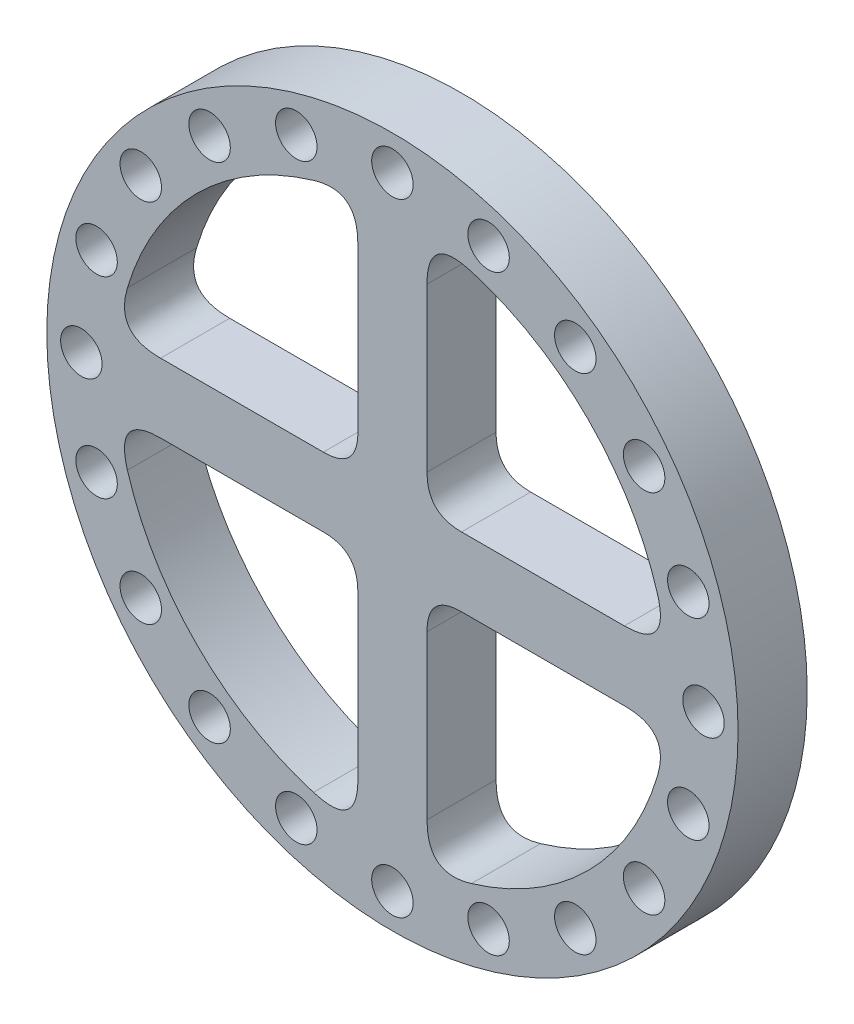
from build123d import *

# Parameters (mm, degrees)
ESBO_O1_R                = 50
ESBO_O1_R_2              = 40
RESSALTO_EXTRUS_O1_DEPTH = 10
ESBO_O2_R                = 3
CORTE_EXTRUS_O1_DEPTH    = 10
RESSALTO_EXTRUS_O2_START = -10
RESSALTO_EXTRUS_O2_DEPTH = 10
FILETE3_SIZE             = 5


with BuildPart() as part:
    # Esboço1 → Ressalto-extrusão1 (new body)
    with BuildSketch(Plane.XY):
        Circle(ESBO_O1_R)
        Circle(ESBO_O1_R_2, mode=Mode.SUBTRACT)
    extrude(amount=RESSALTO_EXTRUS_O1_DEPTH)

    # Esboço2 → Corte-extrusão1 (cut)
    with BuildSketch(Plane.XY.offset(10)):
        with Locations((45, 0)):
            Circle(ESBO_O2_R)
        with Locations((42.797543233, -13.905764747)):
            Circle(ESBO_O2_R)
        with Locations((36.405764747, -26.450336353)):
            Circle(ESBO_O2_R)
        with Locations((26.450336353, -36.405764747)):
            Circle(ESBO_O2_R)
        with Locations((13.905764747, -42.797543233)):
            Circle(ESBO_O2_R)
        with Locations((0, -45)):
            Circle(ESBO_O2_R)
        with Locations((-13.905764747, -42.797543233)):
            Circle(ESBO_O2_R)
        with Locations((-26.450336353, -36.405764747)):
            Circle(ESBO_O2_R)
        with Locations((-36.405764747, -26.450336353)):
            Circle(ESBO_O2_R)
        with Locations((-42.797543233, -13.905764747)):
            Circle(ESBO_O2_R)
        with Locations((-45, 0)):
            Circle(ESBO_O2_R)
        with Locations((-42.797543233, 13.905764747)):
            Circle(ESBO_O2_R)
        with Locations((-36.405764747, 26.450336353)):
            Circle(ESBO_O2_R)
        with Locations((-26.450336353, 36.405764747)):
            Circle(ESBO_O2_R)
        with Locations((-13.905764747, 42.797543233)):
            Circle(ESBO_O2_R)
        with Locations((0, 45)):
            Circle(ESBO_O2_R)
        with Locations((13.905764747, 42.797543233)):
            Circle(ESBO_O2_R)
        with Locations((26.450336353, 36.405764747)):
            Circle(ESBO_O2_R)
        with Locations((36.405764747, 26.450336353)):
            Circle(ESBO_O2_R)
        with Locations((42.797543233, 13.905764747)):
            Circle(ESBO_O2_R)
    extrude(amount=-CORTE_EXTRUS_O1_DEPTH, mode=Mode.SUBTRACT)

    # Esboço3 → Ressalto-extrusão2 (add)
    with BuildSketch(Plane.XY.offset(10).offset(RESSALTO_EXTRUS_O2_START)):
        with BuildLine():
            Line((-39.686269666, -5), (-5, -5))
            Line((-5, -5), (-5, -39.686269666))
            ThreePointArc((-5, -39.686269666), (0, -40), (5, -39.686269666))
            Line((5, -39.686269666), (5, -5))
            Line((5, -5), (39.686269666, -5))
            ThreePointArc((39.686269666, -5), (40, 0), (39.686269666, 5))
            Line((39.686269666, 5), (5, 5))
            Line((5, 5), (5, 39.686269666))
            ThreePointArc((5, 39.686269666), (0, 40), (-5, 39.686269666))
            Line((-5, 39.686269666), (-5, 5))
            Line((-5, 5), (-39.686269666, 5))
            ThreePointArc((-39.686269666, 5), (-40, 0), (-39.686269666, -5))
        make_face()
    extrude(amount=RESSALTO_EXTRUS_O2_DEPTH)

    # Filete3
    # a fillet whose section is not a circle: 5 mm, written as the material it adds along each edge
    with BuildSketch(Plane(origin=(-39.686269666, -5, 0), x_dir=(0.20605308678190473, -0.9785408143903089, 0), z_dir=(0, 0, 1)), Plane(origin=(39.686269666, 5, 0), x_dir=(-0.206053086781907, 0.9785408143903084, 0), z_dir=(0, 0, 1)), Plane(origin=(5, -39.686269666, 0), x_dir=(0.9785408143903085, 0.2060530867819072, 0), z_dir=(0, 0, 1)), Plane(origin=(-5, 39.686269666, 0), x_dir=(-0.9785408143903084, -0.206053086781907, 0), z_dir=(0, 0, 1))) as filete3_piece_1:
        with BuildLine():
            Bezier((6.569548591, 0), (-0.115998395, -0.550873396), (1.266247732, 6.013377943), weights=[1, 1, 1])
            Line((1.266247732, 6.013377943), (0, 0))
            ThreePointArc((0, 0), (3.284774296, -0.135099927), (6.569548591, 0))
        make_face()
    extrude(amount=10)
    with BuildSketch(Plane(origin=(5, 5, 0), x_dir=(1, 0, 0), z_dir=(0, 0, 1)), Plane(origin=(5, -5, 0), x_dir=(0, -1, 0), z_dir=(0, 0, 1)), Plane(origin=(-5, -5, 0), x_dir=(-1, 0, 0), z_dir=(0, 0, 1)), Plane(origin=(-5, 5, 0), x_dir=(0, 1, 0), z_dir=(0, 0, 1))) as filete3_piece_2:
        with BuildLine():
            Bezier((FILETE3_SIZE, 0), (0, 0), (0, FILETE3_SIZE), weights=[1, 1, 1])
            Line((0, FILETE3_SIZE), (0, 0))
            Line((0, 0), (FILETE3_SIZE, 0))
        make_face()
    extrude(amount=10)
    with BuildSketch(Plane(origin=(5, 39.686269666, 0), x_dir=(0.9785408143903086, -0.20605308678190615, 0), z_dir=(0, 0, 1)), Plane(origin=(-5, -39.686269666, 0), x_dir=(-0.9785408143903087, 0.20605308678190526, 0), z_dir=(0, 0, 1)), Plane(origin=(39.686269666, -5, 0), x_dir=(-0.20605308678190642, -0.9785408143903086, 0), z_dir=(0, 0, 1)), Plane(origin=(-39.686269666, 5, 0), x_dir=(0.206053086781904, 0.9785408143903089, 0), z_dir=(0, 0, 1))) as filete3_piece_3:
        with BuildLine():
            Bezier((6.569548591, 0), (-0.115998395, 0.550873396), (1.266247732, -6.013377943), weights=[1, 1, 1])
            Line((1.266247732, -6.013377943), (0, 0))
            ThreePointArc((0, 0), (3.284774296, 0.135099927), (6.569548591, 0))
        make_face()
    extrude(amount=10)


solid = part.part
